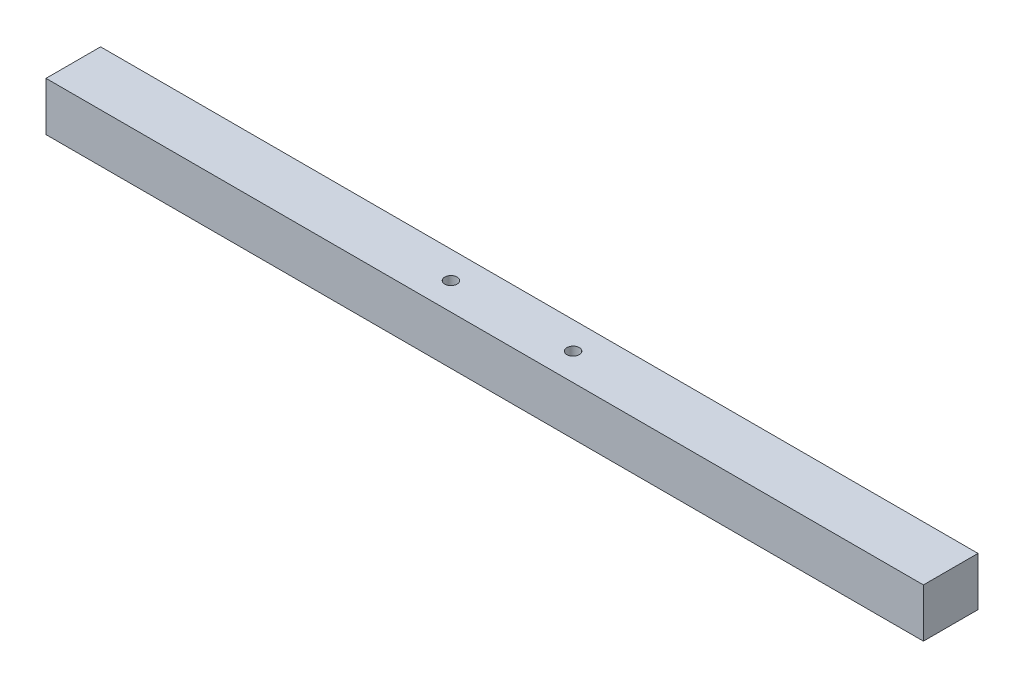
from build123d import *

# Parameters (mm, degrees)
CROQUIS1_W              = 270
CROQUIS1_H              = 16.8
CROQUIS1_R              = 1.9
SALIENTE_EXTRUIR1_DEPTH = 15


with BuildPart() as part:
    # Croquis1 → Saliente-Extruir1 (new body)
    with BuildSketch(Plane(origin=(0, 0, 0), x_dir=(1, 0, 0), z_dir=(0, 1, 0))):
        Rectangle(CROQUIS1_W, CROQUIS1_H)
        with Locations((-18.8, 0)):
            Circle(CROQUIS1_R, mode=Mode.SUBTRACT)
        with Locations((18.8, 0)):
            Circle(CROQUIS1_R, mode=Mode.SUBTRACT)
    extrude(amount=SALIENTE_EXTRUIR1_DEPTH)


solid = part.part
